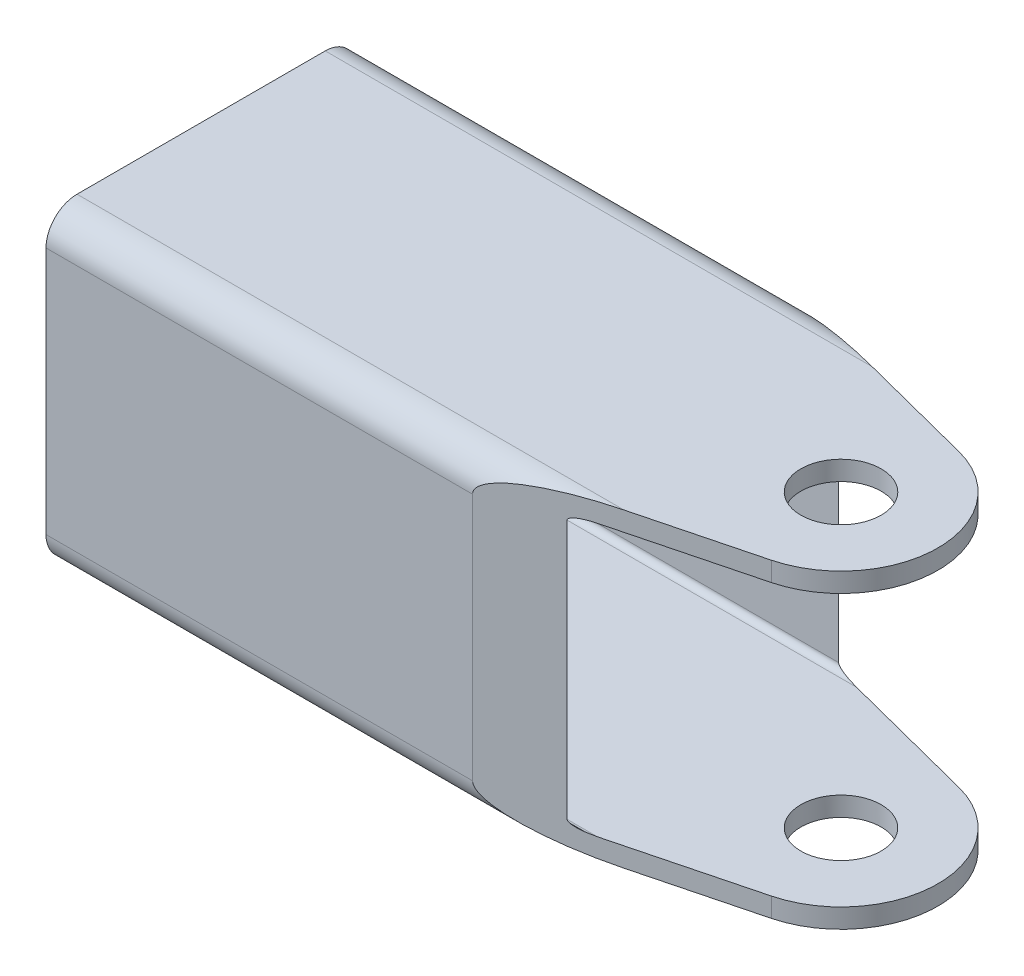
from build123d import *

# Parameters (mm, degrees)
BOSS_EXTRUDE1_DEPTH      = 25.4
BOSS_EXTRUDE1_DEPTH_BACK = 34.925
CUT_EXTRUDE4_DEPTH       = 63.941922635
CUT_EXTRUDE5_DEPTH       = 46.01339384
SKETCH14_R               = 3.2893
CUT_EXTRUDE6_DEPTH       = 46.01339384


with BuildPart() as part:
    # Sketch1 → Boss-Extrude1 (new, two sides: drawn at the far end of the back side and taken through both)
    with BuildSketch(Plane(origin=(0, 0, 0), x_dir=(0, 0, -1), z_dir=(1, 0, 0)).offset(-BOSS_EXTRUDE1_DEPTH_BACK)):
        with BuildLine():
            Line((-10.16, 12.7), (10.16, 12.7))
            ThreePointArc((10.16, 12.7), (11.956051224, 11.956051224), (12.7, 10.16))
            Line((12.7, 10.16), (12.7, -10.16))
            ThreePointArc((12.7, -10.16), (11.956051224, -11.956051224), (10.16, -12.7))
            Line((10.16, -12.7), (-10.16, -12.7))
            ThreePointArc((-10.16, -12.7), (-11.956051224, -11.956051224), (-12.7, -10.16))
            Line((-12.7, -10.16), (-12.7, 10.16))
            ThreePointArc((-12.7, 10.16), (-11.956051224, 11.956051224), (-10.16, 12.7))
        make_face()
    extrude(amount=BOSS_EXTRUDE1_DEPTH + BOSS_EXTRUDE1_DEPTH_BACK)

    # Sketch11 → Cut-Extrude4 (cut, through all)
    with BuildSketch(Plane(origin=(25.4, 0, 0), x_dir=(0, 0, -1), z_dir=(1, 0, 0))):
        with BuildLine():
            Line((-10.6045, 11.1125), (10.6045, 11.1125))
            ThreePointArc((10.6045, 11.1125), (10.963710245, 10.963710245), (11.1125, 10.6045))
            Line((11.1125, 10.6045), (11.1125, -10.6045))
            ThreePointArc((11.1125, -10.6045), (10.963710245, -10.963710245), (10.6045, -11.1125))
            Line((10.6045, -11.1125), (-10.6045, -11.1125))
            ThreePointArc((-10.6045, -11.1125), (-10.963710245, -10.963710245), (-11.1125, -10.6045))
            Line((-11.1125, -10.6045), (-11.1125, 10.6045))
            ThreePointArc((-11.1125, 10.6045), (-10.963710245, 10.963710245), (-10.6045, 11.1125))
        make_face()
    extrude(amount=-CUT_EXTRUDE4_DEPTH, mode=Mode.SUBTRACT)

    # Sketch12 → Cut-Extrude5 (cut, through all)
    with BuildSketch(Plane(origin=(0, 12.7, 0), x_dir=(1, 0, 0), z_dir=(0, 1, 0))):
        with BuildLine():
            Line((50.8, 12.7), (0, 12.7))
            Line((0, 12.7), (19.444424463, 7.686083637))
            ThreePointArc((19.444424463, 7.686083637), (25.4, 0), (19.444424463, -7.686083637))
            Line((19.444424463, -7.686083637), (0, -12.7))
            Line((0, -12.7), (50.8, -12.7))
            Line((50.8, -12.7), (50.8, 12.7))
        make_face()
    extrude(amount=-CUT_EXTRUDE5_DEPTH, mode=Mode.SUBTRACT)

    # Sketch14 → Cut-Extrude6 (cut, through all)
    with BuildSketch(Plane(origin=(0, 12.7, 0), x_dir=(1, 0, 0), z_dir=(0, 1, 0))):
        with Locations((17.4625, 0)):
            Circle(SKETCH14_R)
    extrude(amount=-CUT_EXTRUDE6_DEPTH, mode=Mode.SUBTRACT)


solid = part.part
